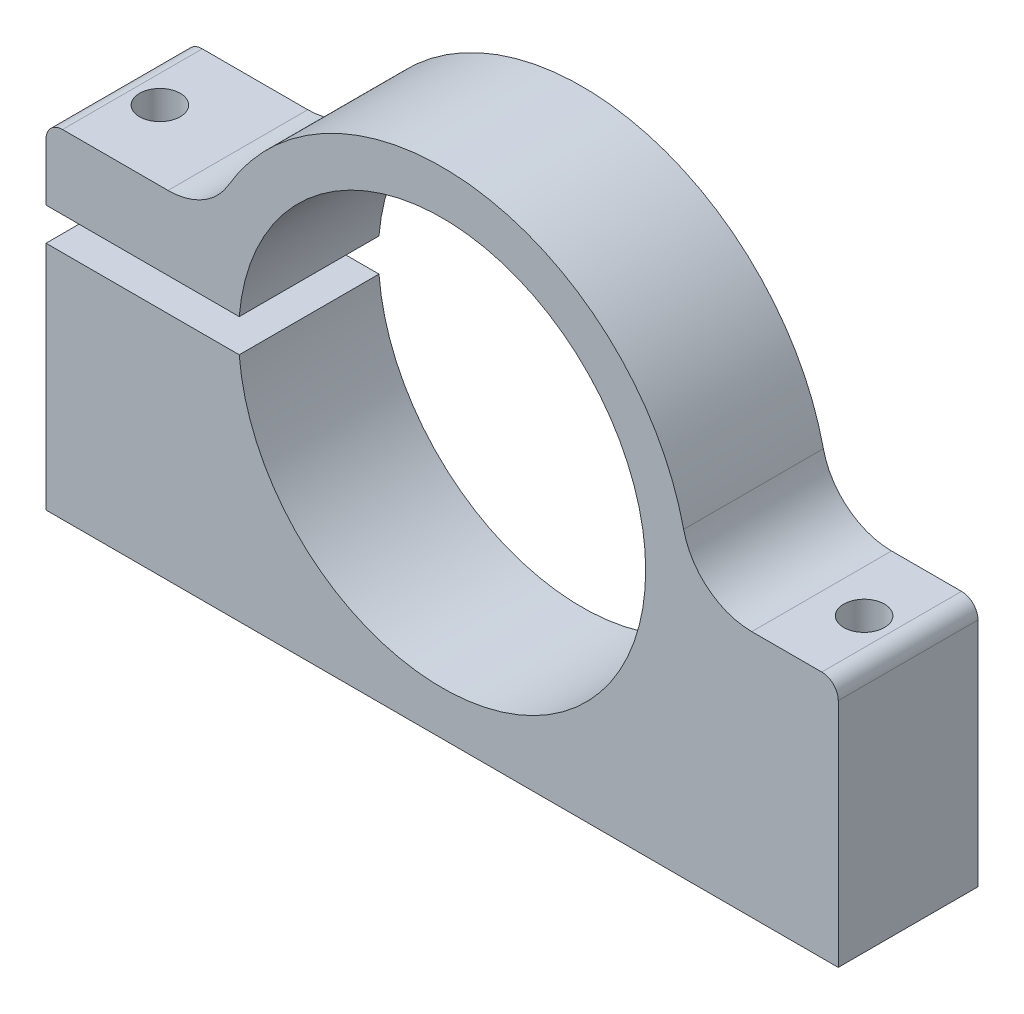
from build123d import *

# Parameters (mm, degrees)
BOSS_EXTRUDE1_DEPTH            = 12.7
CUT_EXTRUDE1_DEPTH             = 45.311849431
SKETCH3_W                      = 18.5
SKETCH3_H                      = 12.7
F_3_7_3_7_DIAMETER_HOLE1_D     = 3.7
F_3_7_3_7_DIAMETER_HOLE1_DEPTH = 6.7
F_3_7_3_7_DIAMETER_HOLE2_D     = 3.7
F_3_7_3_7_DIAMETER_HOLE2_DEPTH = 45
F_3_7_3_7_DIAMETER_HOLE3_D     = 3.7
F_3_7_3_7_DIAMETER_HOLE3_DEPTH = 45
FILLET1_R                      = 1.5
FILLET2_R                      = 6.35


with BuildPart() as part:
    # Sketch1 → Boss-Extrude1 (new body)
    with BuildSketch(Plane.XY.offset(6.35)):
        with BuildLine():
            Line((-20.952565475, 8.2), (-36, 8.2))
            Line((-36, 8.2), (-36, -22.5))
            Line((-36, -22.5), (36, -22.5))
            Line((36, -22.5), (36, 0))
            Line((36, 0), (22.5, 0))
            ThreePointArc((22.5, 0), (4.172366044, 22.109757158), (-20.952565475, 8.2))
        make_face()
    extrude(amount=-BOSS_EXTRUDE1_DEPTH)

    # Sketch2 → Cut-Extrude1 (cut, through all)
    with BuildSketch(Plane(origin=(0, 0, -6.35), x_dir=(-1, 0, 0), z_dir=(0, 0, -1))):
        with BuildLine():
            Line((36, 1.5), (18.439088915, 1.5))
            ThreePointArc((18.439088915, 1.5), (18.5, 0), (18.439088915, -1.5))
            Line((18.439088915, -1.5), (36, -1.5))
            Line((36, -1.5), (36, 1.5))
        make_face()
    extrude(amount=-CUT_EXTRUDE1_DEPTH, mode=Mode.SUBTRACT)

    # Sketch3 → Cut-Revolve1 (revolve, cut)
    with BuildSketch(Plane(origin=(0, 0, 0), x_dir=(1, 0, 0), z_dir=(0, 1, 0))):
        with Locations((9.25, 0)):
            Rectangle(SKETCH3_W, SKETCH3_H)
    revolve(axis=Axis((0, 0, -6.35), (0, 0, 1)), mode=Mode.SUBTRACT)

    # Ø3.7 (3.7) Diameter Hole1
    with Locations(Plane(origin=(0, 8.2, 0), x_dir=(1, 0, 0), z_dir=(0, 1, 0))):
        with Locations((-32, 0)):
            Hole(F_3_7_3_7_DIAMETER_HOLE1_D / 2, depth=F_3_7_3_7_DIAMETER_HOLE1_DEPTH)

    # Ø3.7 (3.7) Diameter Hole2
    with Locations(Plane(origin=(0, -22.5, 0), x_dir=(-1, 0, 0), z_dir=(0, -1, 0))):
        with Locations((32, 0)):
            Hole(F_3_7_3_7_DIAMETER_HOLE2_D / 2, depth=F_3_7_3_7_DIAMETER_HOLE2_DEPTH)

    # Ø3.7 (3.7) Diameter Hole3
    with Locations(Plane(origin=(0, -22.5, 0), x_dir=(-1, 0, 0), z_dir=(0, -1, 0))):
        with Locations((-32, 0)):
            Hole(F_3_7_3_7_DIAMETER_HOLE3_D / 2, depth=F_3_7_3_7_DIAMETER_HOLE3_DEPTH)

    # Fillet1
    fillet1_edges = [part.edges().sort_by_distance(p)[0] for p in [
        (-36, 8.2, 0),
        (36, 0, 0),
    ]]
    fillet(fillet1_edges, radius=FILLET1_R)

    # Fillet2
    fillet2_edges = [part.edges().sort_by_distance(p)[0] for p in [
        (-20.952565475, 8.2, 0),
        (22.5, 0, 0),
    ]]
    fillet(fillet2_edges, radius=FILLET2_R)


solid = part.part
